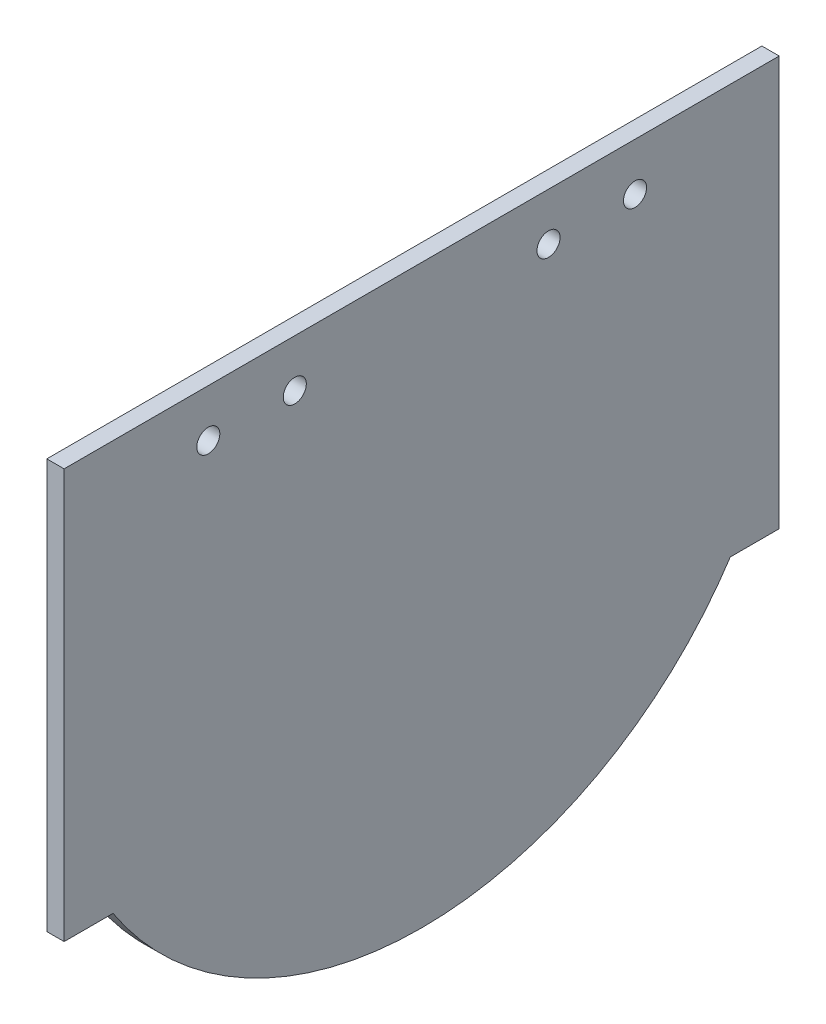
from build123d import *

# Parameters (mm, degrees)
IMPORTED_START          = -3
IMPORTED_BODY_4_1_DEPTH = 3
SKETCH_1_R              = 2
CUT_EXTRUDE_1_DEPTH     = 3
SKETCH_2_W              = 30
SKETCH_2_H              = 3
SKETCH_2_W_2            = 3
SKETCH_2_H_2            = 30
EXTRUDE_1_DEPTH         = 3
CUT_EXTRUDE_2_DEPTH     = 3


# Read off the part's stored shape, not the designer's step: 基体零件-零件4-1
with BuildPart() as part:
    # 基体零件-零件4-1 outline → 基体零件-零件4-1 (new body)
    with BuildSketch(Plane.YZ.offset(IMPORTED_START)):
        Polygon((-3, -3), (0, -3), (0, 0), (9.999598957, 0), (9.999598957, 3), (20.000401043, 3), (20.000401043, 0), (30, 0), (30, -3), (52, -3), (52, 0), (82, 0), (82, -3), (104, -3), (104, 19), (101, 19), (101, 49), (104, 49), (104, 69), (101, 69), (101, 99), (104, 99), (104, 121), (82, 121), (82, 118), (52, 118), (52, 121), (30, 121), (30, 118), (20.000401043, 118), (20.000401043, 115), (9.999598957, 115), (9.999598957, 118), (0, 118), (0, 121), (-3, 121), (-3, 99), (0, 99), (0, 69), (-3, 69), (-3, 49), (0, 49), (0, 19), (-3, 19), align=None)
    extrude(amount=IMPORTED_BODY_4_1_DEPTH)

    # 草图1 → 切除-拉伸1 (cut)
    with BuildSketch(Plane(origin=(0, 0, 0), x_dir=(0, 0, -1), z_dir=(1, 0, 0))):
        with Locations((-96, 95.751318052)):
            Circle(SKETCH_1_R)
        with Locations((-81, 95.751318052)):
            Circle(SKETCH_1_R)
        with Locations((-37, 95.751318052)):
            Circle(SKETCH_1_R)
        with Locations((-22, 95.751318052)):
            Circle(SKETCH_1_R)
    extrude(amount=-CUT_EXTRUDE_1_DEPTH, mode=Mode.SUBTRACT)

    # 草图2 → 凸台-拉伸1 (add)
    with BuildSketch(Plane(origin=(0, 0, 0), x_dir=(0, 0, -1), z_dir=(1, 0, 0))):
        with Locations((-84, 102.5)):
            Rectangle(SKETCH_2_W, SKETCH_2_H)
        with Locations((-34, 102.5)):
            Rectangle(SKETCH_2_W, SKETCH_2_H)
        with Locations((-119.5, 67)):
            Rectangle(SKETCH_2_W_2, SKETCH_2_H_2)
        with Locations((1.5, 67)):
            Rectangle(SKETCH_2_W_2, SKETCH_2_H_2)
    extrude(amount=-EXTRUDE_1_DEPTH)

    # 草图3 → 切除-拉伸2 (cut)
    with BuildSketch(Plane(origin=(0, 0, 0), x_dir=(0, 0, -1), z_dir=(1, 0, 0))):
        with BuildLine():
            Line((-112.520298482, 33), (-121, 33))
            Line((-121, 33), (-121, -3))
            Line((-121, -3), (3, -3))
            Line((3, -3), (3, 33))
            Line((3, 33), (-5.479701518, 33))
            ThreePointArc((-5.479701518, 33), (-59, 4.051408541), (-112.520298482, 33))
        make_face()
    extrude(amount=-CUT_EXTRUDE_2_DEPTH, mode=Mode.SUBTRACT)


solid = part.part
